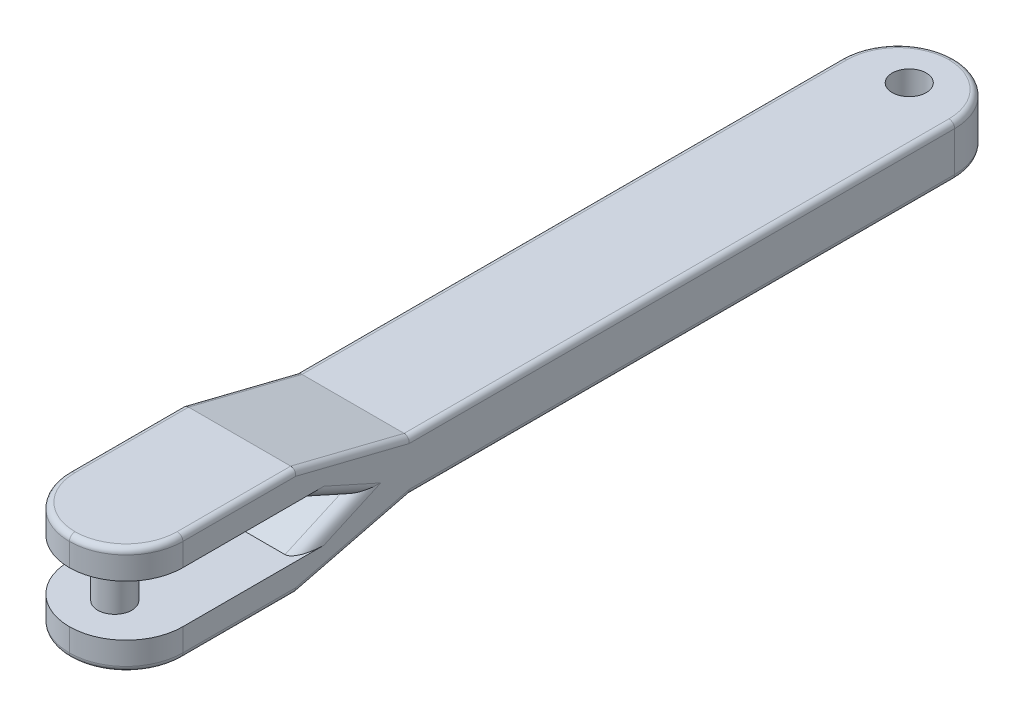
from build123d import *

# Parameters (mm, degrees)
BOSS_EXTRUDE1_DEPTH     = 50
CUT_EXTRUDE1_DEPTH      = 745.983221288
CUT_EXTRUDE1_DEPTH_BACK = 745.983221288
SKETCH3_R               = 15
SKETCH4_R               = 15
BOSS_EXTRUDE2_DEPTH     = 95
FILLET1_R               = 50
FILLET2_R               = 10
FILLET3_R               = 50
FILLET4_R               = 5


with BuildPart() as part:
    # Sketch2 → Boss-Extrude1 (new, symmetric)
    with BuildSketch(Plane(origin=(0, 0, 0), x_dir=(0, 0, -1), z_dir=(1, 0, 0))):
        Polygon((0, -22.5), (40, -22.5), (40, 22.5), (0, 22.5), (-490, 22.5), (-590, 47.5), (-740, 47.5), (-740, 22.5), (-590, 22.5), (-540, 0), (-590, -22.5), (-740, -22.5), (-740, -47.5), (-590, -47.5), (-490, -22.5), align=None)
    extrude(amount=BOSS_EXTRUDE1_DEPTH, both=True)

    # Sketch3 → Cut-Extrude1 (cut, two sides: drawn at the far end of the back side and taken through both)
    with BuildSketch(Plane.XZ.offset(22.5).offset(-CUT_EXTRUDE1_DEPTH_BACK)):
        with Locations(Location((0, 0, 0), (0, 0, 270))):
            Circle(SKETCH3_R)
    extrude(amount=CUT_EXTRUDE1_DEPTH + CUT_EXTRUDE1_DEPTH_BACK, mode=Mode.SUBTRACT)

    # Sketch4 → Boss-Extrude2 (add)
    with BuildSketch(Plane.XZ.offset(47.5)):
        with Locations(Location((0, 700, 0), (0, 0, 270))):
            Circle(SKETCH4_R)
    extrude(amount=-BOSS_EXTRUDE2_DEPTH)

    # Fillet1
    fillet1_edges = [part.edges().sort_by_distance(p)[0] for p in [
        (50, 0, -40),
        (-50, 0, -40),
    ]]
    fillet(fillet1_edges, radius=FILLET1_R - 0.0001)  # a hair under: the kernel refuses the full size

    # Fillet2
    fillet2_edges = [part.edges().sort_by_distance(p)[0] for p in [
        (-50, -11.25, 565),
        (-50, 11.25, 565),
        (50, 11.25, 565),
        (50, -11.25, 565),
    ]]
    fillet(fillet2_edges, radius=FILLET2_R)

    # Fillet3
    fillet3_edges = [part.edges().sort_by_distance(p)[0] for p in [
        (-50, -35, 740),
        (-50, 35, 740),
        (50, 35, 740),
        (50, -35, 740),
    ]]
    fillet(fillet3_edges, radius=FILLET3_R - 0.0001)  # a hair under: the kernel refuses the full size

    # Fillet4
    fillet4_edges = [part.edges().sort_by_distance(p)[0] for p in [
        (-50, -47.5, 640.00005),
        (50, -47.5, 640.00005),
        (35.355368349, -47.5, 725.355368349),
        (-35.355368349, -47.5, 725.355368349),
        (35.355368349, 47.5, 725.355368349),
        (-35.355368349, 47.5, 725.355368349),
        (-50, -35, 540),
        (-50, 47.5, 640.00005),
        (-50, 35, 540),
        (-50, -22.5, 249.99995),
        (50, 35, 540),
        (50, 47.5, 640.00005),
        (50, -22.5, 249.99995),
        (50, 22.5, 249.99995),
        (50, -35, 540),
        (-50, 22.5, 249.99995),
        (-35.355368349, 22.5, -25.355368349),
        (35.355368349, 22.5, -25.355368349),
        (-35.355368349, -22.5, -25.355368349),
        (35.355368349, -22.5, -25.355368349),
    ]]
    fillet(fillet4_edges, radius=FILLET4_R)


solid = part.part
